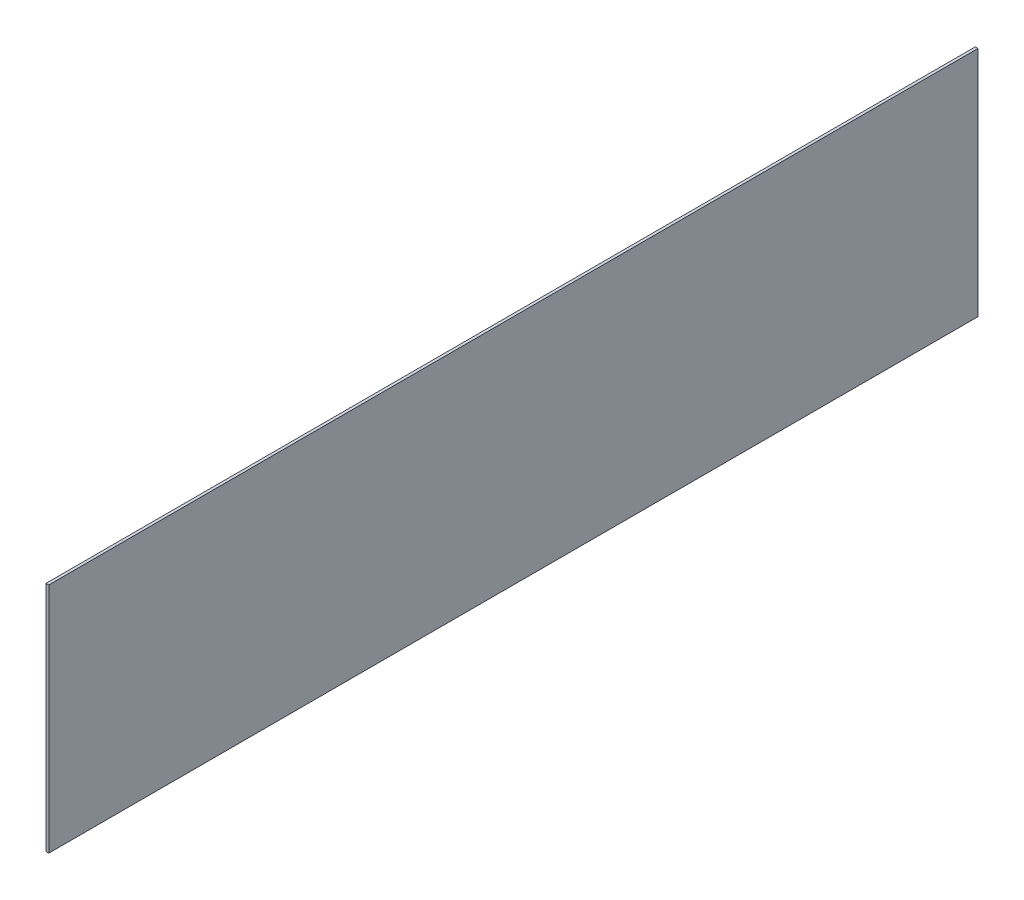
from build123d import *

# Parameters (mm, degrees)
SKETCH1_W           = 533.4
SKETCH1_H           = 133.35
BOSS_EXTRUDE1_DEPTH = 1.5875


with BuildPart() as part:
    # Sketch1 → Boss-Extrude1 (new body)
    with BuildSketch(Plane(origin=(0, 0, 0), x_dir=(0, 0, -1), z_dir=(1, 0, 0))):
        with Locations((266.7, 66.675)):
            Rectangle(SKETCH1_W, SKETCH1_H)
    extrude(amount=BOSS_EXTRUDE1_DEPTH)


solid = part.part
